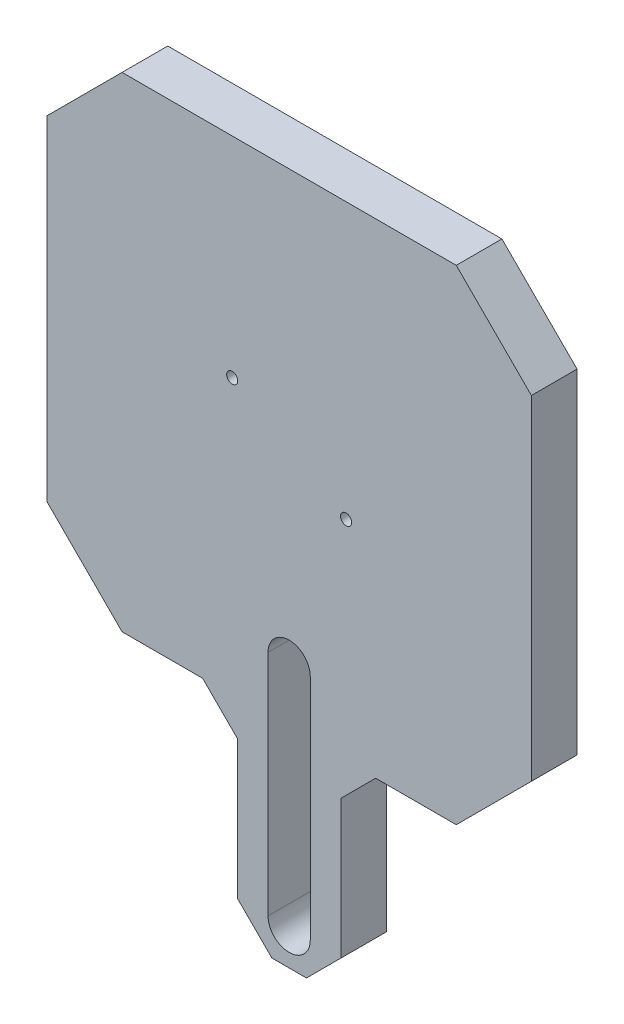
from build123d import *

# Parameters (mm, degrees)
BOSS_EXTRUDE1_DEPTH             = 6.6
SKETCH4_R                       = 11.5
CUT_EXTRUDE2_DEPTH              = 4.9
SKETCH5_R                       = 13.5
SKETCH5_R_2                     = 11.5
CUT_EXTRUDE3_DEPTH              = 2.3
SKETCH12_R                      = 0.8
CUT_EXTRUDE5_DEPTH              = 63.296330123
CUT_EXTRUDE6_DEPTH              = 10
CUT_EXTRUDE7_REACH              = 68.423
SKETCH18_W                      = 2
SKETCH18_H                      = 2.9
SKETCH19_W                      = 5.7
SKETCH19_H                      = 5
CUT_EXTRUDE8_DEPTH              = 9
CUT_EXTRUDE9_DEPTH              = 3.175
BOSS_EXTRUDE2_DEPTH             = 6.6
BOSS_EXTRUDE3_DEPTH             = 10.5
TAP_DRILL_FOR_M2X0_4_TAP1_D     = 1.6
TAP_DRILL_FOR_M2X0_4_TAP1_DEPTH = 3
TAP_DRILL_FOR_M2X0_4_TAP1_TIP   = 0.480688495
SKETCH27_W                      = 15
SKETCH27_H                      = 30
BOSS_EXTRUDE4_DEPTH             = 6.6
SKETCH28_W                      = 15
SKETCH28_H                      = 19
BOSS_EXTRUDE5_DEPTH             = 6.6
CUT_EXTRUDE11_DEPTH             = 77.52919612
CHAMFER1_SIZE                   = 5
CUT_EXTRUDE12_START             = -2.9
CUT_EXTRUDE12_DEPTH             = 2.9


# Read off the part's stored shape, not the designer's step: Cut-Extrude12
with BuildPart() as part:
    # Sketch2 → Boss-Extrude1 (new body)
    with BuildSketch(Plane.XY):
        with BuildLine():
            Line((-38.225931781, 44.590823815), (1.774068219, 44.590823815))
            ThreePointArc((1.774068219, 44.590823815), (5.309602125, 43.126357721), (6.774068219, 39.590823815))
            Line((6.774068219, 39.590823815), (6.774068219, -0.409176185))
            ThreePointArc((6.774068219, -0.409176185), (5.309602125, -3.944710091), (1.774068219, -5.409176185))
            Line((1.774068219, -5.409176185), (-38.225931781, -5.409176185))
            ThreePointArc((-38.225931781, -5.409176185), (-41.761465687, -3.944710091), (-43.225931781, -0.409176185))
            Line((-43.225931781, -0.409176185), (-43.225931781, 39.590823815))
            ThreePointArc((-43.225931781, 39.590823815), (-41.761465687, 43.126357721), (-38.225931781, 44.590823815))
        make_face()
    extrude(amount=BOSS_EXTRUDE1_DEPTH)

    # Sketch4 → Cut-Extrude2 (cut)
    with BuildSketch(Plane(origin=(0, 0, 0), x_dir=(-1, 0, 0), z_dir=(0, 0, -1))):
        with Locations((18.225931781, 19.590823815)):
            Circle(SKETCH4_R)
    extrude(amount=-CUT_EXTRUDE2_DEPTH, mode=Mode.SUBTRACT)

    # Sketch5 → Cut-Extrude3 (cut)
    with BuildSketch(Plane(origin=(0, 0, 0), x_dir=(-1, 0, 0), z_dir=(0, 0, -1))):
        with Locations((18.225931781, 19.590823815)):
            Circle(SKETCH5_R)
        with Locations((18.225931781, 19.590823815)):
            Circle(SKETCH5_R_2, mode=Mode.SUBTRACT)
    extrude(amount=-CUT_EXTRUDE3_DEPTH, mode=Mode.SUBTRACT)

    # Sketch12 → Cut-Extrude5 (cut, through all)
    with BuildSketch(Plane(origin=(0, 0, 4.9), x_dir=(-1, 0, 0), z_dir=(0, 0, -1))):
        with Locations((26.453173117, 24.340823815)):
            Circle(SKETCH12_R)
        with Locations((9.998690445, 14.840823815)):
            Circle(SKETCH12_R)
    extrude(amount=-CUT_EXTRUDE5_DEPTH, mode=Mode.SUBTRACT)

    # Sketch13 → Cut-Extrude6 (cut)
    with BuildSketch(Plane(origin=(0, 0, 0), x_dir=(-1, 0, 0), z_dir=(0, 0, -1))):
        with BuildLine():
            Line((-6.774068219, 39.590823815), (-1.774068219, 44.590823815))
            ThreePointArc((-1.774068219, 44.590823815), (-5.309602125, 43.126357721), (-6.774068219, 39.590823815))
        make_face()
        with BuildLine():
            Line((-6.774068219, -0.409176185), (-1.774068219, -5.409176185))
            ThreePointArc((-1.774068219, -5.409176185), (-5.309602125, -3.944710091), (-6.774068219, -0.409176185))
        make_face()
        with BuildLine():
            Line((43.225931781, -0.409176185), (38.225931781, -5.409176185))
            ThreePointArc((38.225931781, -5.409176185), (41.761465687, -3.944710091), (43.225931781, -0.409176185))
        make_face()
        with BuildLine():
            Line((38.225931781, 44.590823815), (43.225931781, 39.590823815))
            ThreePointArc((43.225931781, 39.590823815), (41.761465687, 43.126357721), (38.225931781, 44.590823815))
        make_face()
    extrude(amount=-CUT_EXTRUDE6_DEPTH, mode=Mode.SUBTRACT)

    # Sketch18 → Cut-Extrude7 (cut, up to next)
    with BuildSketch(Plane.XZ.offset(5.409176185), mode=Mode.PRIVATE) as cut_extrude7_sk1:
        with Locations((-17.225931781, 1.45)):
            Rectangle(SKETCH18_W, SKETCH18_H)
    cut_extrude7_tool1 = extrude(cut_extrude7_sk1.sketch, amount=-CUT_EXTRUDE7_REACH, mode=Mode.PRIVATE) & part.part
    # Sketch18 → Cut-Extrude7 (cut, up to next)
    with BuildSketch(Plane.XZ.offset(5.409176185), mode=Mode.PRIVATE) as cut_extrude7_sk2:
        with Locations((-19.225931781, 1.45)):
            Rectangle(SKETCH18_W, SKETCH18_H)
    cut_extrude7_tool2 = extrude(cut_extrude7_sk2.sketch, amount=-CUT_EXTRUDE7_REACH, mode=Mode.PRIVATE) & part.part
    add(cut_extrude7_tool1.solids().sort_by_distance((-17.225932, -5.409176, 1.45))[0], mode=Mode.SUBTRACT)
    add(cut_extrude7_tool2.solids().sort_by_distance((-19.225932, -5.409176, 1.45))[0], mode=Mode.SUBTRACT)

    # Sketch19 → Cut-Extrude8 (cut)
    with BuildSketch(Plane.XZ.offset(5.409176185)):
        with Locations((-18.225931781, 2.5)):
            Rectangle(SKETCH19_W, SKETCH19_H)
    extrude(amount=-CUT_EXTRUDE8_DEPTH, mode=Mode.SUBTRACT)

    # Sketch20 → Cut-Extrude9 (cut)
    with BuildSketch(Plane(origin=(0, 0, 0), x_dir=(-1, 0, 0), z_dir=(0, 0, -1))):
        with BuildLine():
            ThreePointArc((2.525931781, 19.590823815), (-0.774068219, 22.890823815), (-4.074068219, 19.590823815))
            Line((-4.074068219, 19.590823815), (-0.774068219, 19.590823815))
            Line((-0.774068219, 19.590823815), (2.525931781, 19.590823815))
        make_face()
        with BuildLine():
            Line((-0.774068219, 19.590823815), (-4.074068219, 19.590823815))
            ThreePointArc((-4.074068219, 19.590823815), (-0.774068219, 16.290823815), (2.525931781, 19.590823815))
            Line((2.525931781, 19.590823815), (-0.774068219, 19.590823815))
        make_face()
        with BuildLine():
            ThreePointArc((33.925931781, 19.590823815), (37.225931781, 16.290823815), (40.525931781, 19.590823815))
            Line((40.525931781, 19.590823815), (37.225931781, 19.590823815))
            Line((37.225931781, 19.590823815), (33.925931781, 19.590823815))
        make_face()
        with BuildLine():
            Line((37.225931781, 19.590823815), (40.525931781, 19.590823815))
            ThreePointArc((40.525931781, 19.590823815), (37.225931781, 22.890823815), (33.925931781, 19.590823815))
            Line((33.925931781, 19.590823815), (37.225931781, 19.590823815))
        make_face()
    extrude(amount=-CUT_EXTRUDE9_DEPTH, mode=Mode.SUBTRACT)

    # Sketch21 → Boss-Extrude2 (add)
    with BuildSketch(Plane(origin=(0, 0, 0), x_dir=(-1, 0, 0), z_dir=(0, 0, -1))):
        with BuildLine():
            Line((15.375931781, -5.409176185), (-1.774068219, -5.409176185))
            Line((-1.774068219, -5.409176185), (-6.774068219, -0.409176185))
            Line((-6.774068219, -0.409176185), (-6.774068219, 39.590823815))
            Line((-6.774068219, 39.590823815), (-1.774068219, 44.590823815))
            Line((-1.774068219, 44.590823815), (38.225931781, 44.590823815))
            Line((38.225931781, 44.590823815), (43.225931781, 39.590823815))
            Line((43.225931781, 39.590823815), (43.225931781, -0.409176185))
            Line((43.225931781, -0.409176185), (38.225931781, -5.409176185))
            Line((38.225931781, -5.409176185), (21.075931781, -5.409176185))
            Line((21.075931781, -5.409176185), (21.075931781, -14.409176185))
            ThreePointArc((21.075931781, -14.409176185), (21.368825, -15.116282966), (22.075931781, -15.409176185))
            Line((22.075931781, -15.409176185), (42.368067404, -15.409176185))
            Line((42.368067404, -15.409176185), (53.225931781, -4.551311808))
            Line((53.225931781, -4.551311808), (53.225931781, 43.732959439))
            Line((53.225931781, 43.732959439), (42.368067404, 54.590823815))
            Line((42.368067404, 54.590823815), (-5.916203843, 54.590823815))
            Line((-5.916203843, 54.590823815), (-16.774068219, 43.732959439))
            Line((-16.774068219, 43.732959439), (-16.774068219, -4.551311808))
            Line((-16.774068219, -4.551311808), (-5.916203843, -15.409176185))
            Line((-5.916203843, -15.409176185), (14.375931781, -15.409176185))
            ThreePointArc((14.375931781, -15.409176185), (15.083038562, -15.116282966), (15.375931781, -14.409176185))
            Line((15.375931781, -14.409176185), (15.375931781, -5.409176185))
        make_face()
    extrude(amount=-BOSS_EXTRUDE2_DEPTH)

    # Sketch23 → Boss-Extrude3 (add)
    with BuildSketch(Plane.XZ.offset(-3.590823815)):
        Polygon((-15.375931781, 5), (-21.075931781, 5), (-21.075931781, 0), (-20.225931781, 0), (-20.225931781, 2.9), (-16.225931781, 2.9), (-16.225931781, 0), (-15.375931781, 0), align=None)
    extrude(amount=BOSS_EXTRUDE3_DEPTH)

    # Tap Drill for M2x0.4 Tap1
    with Locations(Plane(origin=(0.738534313, 0.626357721, 0), x_dir=(-1, 0, 0), z_dir=(0, 0, -1))):
        with Locations((0, 0), (0, 37.928932188), (37.928932188, 0), (37.928932188, 37.928932188)):
            Hole(TAP_DRILL_FOR_M2X0_4_TAP1_D / 2, depth=TAP_DRILL_FOR_M2X0_4_TAP1_DEPTH)
            with Locations((0, 0, -(TAP_DRILL_FOR_M2X0_4_TAP1_DEPTH + TAP_DRILL_FOR_M2X0_4_TAP1_TIP / 2))):  # 118° drill point
                Cone(0, TAP_DRILL_FOR_M2X0_4_TAP1_D / 2, TAP_DRILL_FOR_M2X0_4_TAP1_TIP, mode=Mode.SUBTRACT)

    # Sketch27 → Boss-Extrude4 (add)
    with BuildSketch(Plane(origin=(0, 0, 0), x_dir=(-1, 0, 0), z_dir=(0, 0, -1))):
        with Locations((18.225931781, -30.409176185)):
            Rectangle(SKETCH27_W, SKETCH27_H)
    extrude(amount=-BOSS_EXTRUDE4_DEPTH)

    # Sketch28 → Boss-Extrude5 (add)
    with BuildSketch(Plane(origin=(0, 0, 0), x_dir=(-1, 0, 0), z_dir=(0, 0, -1))):
        with Locations((18.225931781, -5.909176185)):
            Rectangle(SKETCH28_W, SKETCH28_H)
    extrude(amount=-BOSS_EXTRUDE5_DEPTH)

    # Sketch29 → Cut-Extrude11 (cut, through all)
    with BuildSketch(Plane(origin=(0, 0, 0), x_dir=(-1, 0, 0), z_dir=(0, 0, -1))):
        with BuildLine():
            Line((15.175931781, -40.409176185), (15.175931781, -7.428532511))
            ThreePointArc((15.175931781, -7.428532511), (18.225931781, -4.378532511), (21.275931781, -7.428532511))
            Line((21.275931781, -7.428532511), (21.275931781, -40.409176185))
            ThreePointArc((21.275931781, -40.409176185), (18.225931781, -43.459176185), (15.175931781, -40.409176185))
        make_face()
    extrude(amount=-CUT_EXTRUDE11_DEPTH, mode=Mode.SUBTRACT)

    # Chamfer1
    chamfer1_edges = [part.edges().sort_by_distance(p)[0] for p in [
        (-25.725931781, -15.409176185, 3.3),
        (-25.725931781, -45.409176185, 3.3),
        (-10.725931781, -45.409176185, 3.3),
        (-10.725931781, -15.409176185, 3.3),
    ]]
    chamfer(chamfer1_edges, length=CHAMFER1_SIZE)

    # Cut-Extrude12 outline → Cut-Extrude12 (cut)
    with BuildSketch(Plane(origin=(0, 0, 0), x_dir=(-1, 0, 0), z_dir=(0, 0, -1)).offset(CUT_EXTRUDE12_START)):
        with BuildLine():
            add(Edge.make_bspline(
                [(20.225931781, 3.590823815), (20.225931781, 3.197350565), (20.182324291, 2.396395622), (19.919073848, 0.921152326), (19.256804009, -0.752947143), (18.020202718, -2.371752636), (16.0157657, -4.007478883), (13.175437439, -5.314382158), (9.671845103, -6.45103665), (6.987103918, -7.443607584), (5.205242074, -8.425581774), (4.089906326, -9.278706893), (3.199613192, -10.284190015), (2.624756347, -11.322907692), (2.27128167, -12.346173133), (2.067968688, -13.226247217), (1.958515289, -14.069133971), (1.912800936, -14.807256698), (1.904863969, -15.21142357), (1.904863969, -15.409176185)],
                knots=[0, 0, 0, 0, 0.03125, 0.0625, 0.125, 0.1875, 0.25, 0.375, 0.5, 0.625, 0.6875, 0.75, 0.8125, 0.875, 0.90625, 0.9375, 0.96875, 0.984375, 1, 1, 1, 1], degree=3))
            Line((20.225931781, 3.590823815), (16.225931781, 3.590823815))
            add(Edge.make_bspline(
                [(16.225931781, 3.590823815), (16.225931781, 3.349695771), (16.197971207, 2.841833913), (16.049721647, 2.039591017), (15.72788709, 1.23822648), (15.139797291, 0.457977067), (14.280464012, -0.260475455), (13.130188953, -0.920694884), (11.263091636, -1.726327354), (8.458607531, -2.642136424), (4.813382385, -3.965993877), (1.865762572, -5.756214715), (-0.098104505, -7.958715934), (-1.233002962, -10.023055027), (-1.819039575, -12.079797564), (-2.055309799, -13.903240173), (-2.095136031, -14.915149533), (-2.095136031, -15.409176185)],
                knots=[0, 0, 0, 0, 0.03125, 0.0625, 0.125, 0.1875, 0.25, 0.3125, 0.375, 0.5, 0.625, 0.75, 0.8125, 0.875, 0.9375, 0.96875, 1, 1, 1, 1], degree=3))
            Line((-2.095136031, -15.409176185), (1.904863969, -15.409176185))
        make_face()
    extrude(amount=CUT_EXTRUDE12_DEPTH, mode=Mode.SUBTRACT)


solid = part.part
